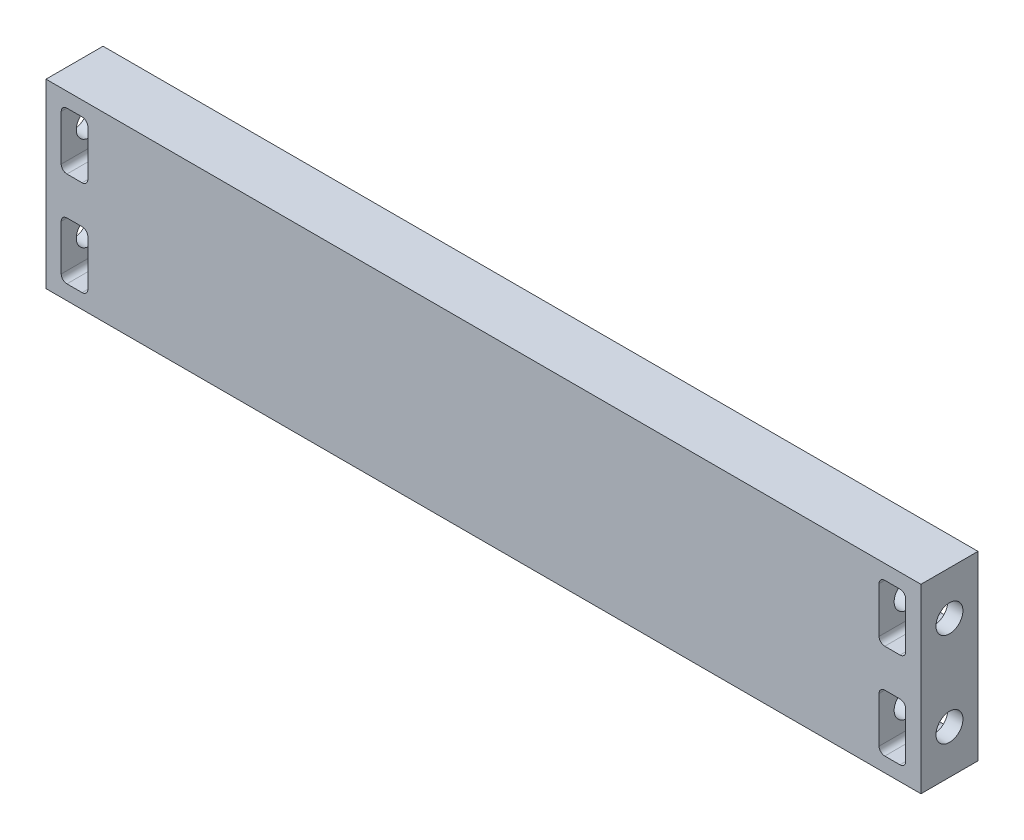
from build123d import *

# Parameters (mm, degrees)
SKETCH1_W                                  = 146.05
SKETCH1_H                                  = 30.287570108
BOSS_EXTRUDE1_DEPTH                        = 9.525
SKETCH2_R                                  = 2.2479
CUT_EXTRUDE1_DEPTH                         = 10.795
MIRROR1_AT_THE_SECOND_PLANE_COPY_1_SKETC_R = 2.2479
MIRROR1_AT_THE_SECOND_PLANE_COPY_1_DEPTH   = 10.795


with BuildPart() as part:
    # Sketch1 → Boss-Extrude1 (new body)
    with BuildSketch(Plane.XY):
        Rectangle(SKETCH1_W, SKETCH1_H)
        with BuildLine():
            Line((-69.5325, 12.7), (-66.9925, 12.7))
            ThreePointArc((-66.9925, 12.7), (-66.318980791, 12.421019209), (-66.04, 11.7475))
            Line((-66.04, 11.7475), (-66.04, 4.1275))
            ThreePointArc((-66.04, 4.1275), (-66.318980791, 3.453980791), (-66.9925, 3.175))
            Line((-66.9925, 3.175), (-69.5325, 3.175))
            ThreePointArc((-69.5325, 3.175), (-70.206019209, 3.453980791), (-70.485, 4.1275))
            Line((-70.485, 4.1275), (-70.485, 11.7475))
            ThreePointArc((-70.485, 11.7475), (-70.206019209, 12.421019209), (-69.5325, 12.7))
        make_face(mode=Mode.SUBTRACT)
        with BuildLine():
            Line((-66.04, -11.7475), (-66.04, -4.1275))
            ThreePointArc((-66.04, -4.1275), (-66.318980791, -3.453980791), (-66.9925, -3.175))
            Line((-66.9925, -3.175), (-69.5325, -3.175))
            ThreePointArc((-69.5325, -3.175), (-70.206019209, -3.453980791), (-70.485, -4.1275))
            Line((-70.485, -4.1275), (-70.485, -11.7475))
            ThreePointArc((-70.485, -11.7475), (-70.206019209, -12.421019209), (-69.5325, -12.7))
            Line((-69.5325, -12.7), (-66.9925, -12.7))
            ThreePointArc((-66.9925, -12.7), (-66.318980791, -12.421019209), (-66.04, -11.7475))
        make_face(mode=Mode.SUBTRACT)
        with BuildLine():
            Line((66.04, 11.7475), (66.04, 4.1275))
            ThreePointArc((66.04, 4.1275), (66.318980791, 3.453980791), (66.9925, 3.175))
            Line((66.9925, 3.175), (69.5325, 3.175))
            ThreePointArc((69.5325, 3.175), (70.206019209, 3.453980791), (70.485, 4.1275))
            Line((70.485, 4.1275), (70.485, 11.7475))
            ThreePointArc((70.485, 11.7475), (70.206019209, 12.421019209), (69.5325, 12.7))
            Line((69.5325, 12.7), (66.9925, 12.7))
            ThreePointArc((66.9925, 12.7), (66.318980791, 12.421019209), (66.04, 11.7475))
        make_face(mode=Mode.SUBTRACT)
        with BuildLine():
            Line((69.5325, -12.7), (66.9925, -12.7))
            ThreePointArc((66.9925, -12.7), (66.318980791, -12.421019209), (66.04, -11.7475))
            Line((66.04, -11.7475), (66.04, -4.1275))
            ThreePointArc((66.04, -4.1275), (66.318980791, -3.453980791), (66.9925, -3.175))
            Line((66.9925, -3.175), (69.5325, -3.175))
            ThreePointArc((69.5325, -3.175), (70.206019209, -3.453980791), (70.485, -4.1275))
            Line((70.485, -4.1275), (70.485, -11.7475))
            ThreePointArc((70.485, -11.7475), (70.206019209, -12.421019209), (69.5325, -12.7))
        make_face(mode=Mode.SUBTRACT)
    extrude(amount=BOSS_EXTRUDE1_DEPTH)

    # Sketch2 → Cut-Extrude1 (cut)
    with BuildSketch(Plane(origin=(73.025, 0, 0), x_dir=(0, 0, -1), z_dir=(1, 0, 0))):
        with Locations((-4.7625, 7.843785054)):
            Circle(SKETCH2_R)
    cut_extrude1 = extrude(amount=-CUT_EXTRUDE1_DEPTH, mode=Mode.SUBTRACT)

    # Mirror1: Cut-Extrude1 across plane
    add(cut_extrude1.mirror(Plane(origin=(0, 0, 0), x_dir=(0, 0, 1), z_dir=(1, 0, 0))), mode=Mode.SUBTRACT)

    # Mirror1 at the second plane: Cut-Extrude1 across plane
    add(cut_extrude1.mirror(Plane.ZX), mode=Mode.SUBTRACT)

    # Mirror1 at the second plane copy 1 sketc → Mirror1 at the second plane copy 1 (cut)
    with BuildSketch(Plane(origin=(-73.025, 0, 0), x_dir=(0, 0, -1), z_dir=(-1, 0, 0))):
        with Locations((-4.7625, 7.843785054)):
            Circle(MIRROR1_AT_THE_SECOND_PLANE_COPY_1_SKETC_R)
    extrude(amount=-MIRROR1_AT_THE_SECOND_PLANE_COPY_1_DEPTH, mode=Mode.SUBTRACT)


solid = part.part
